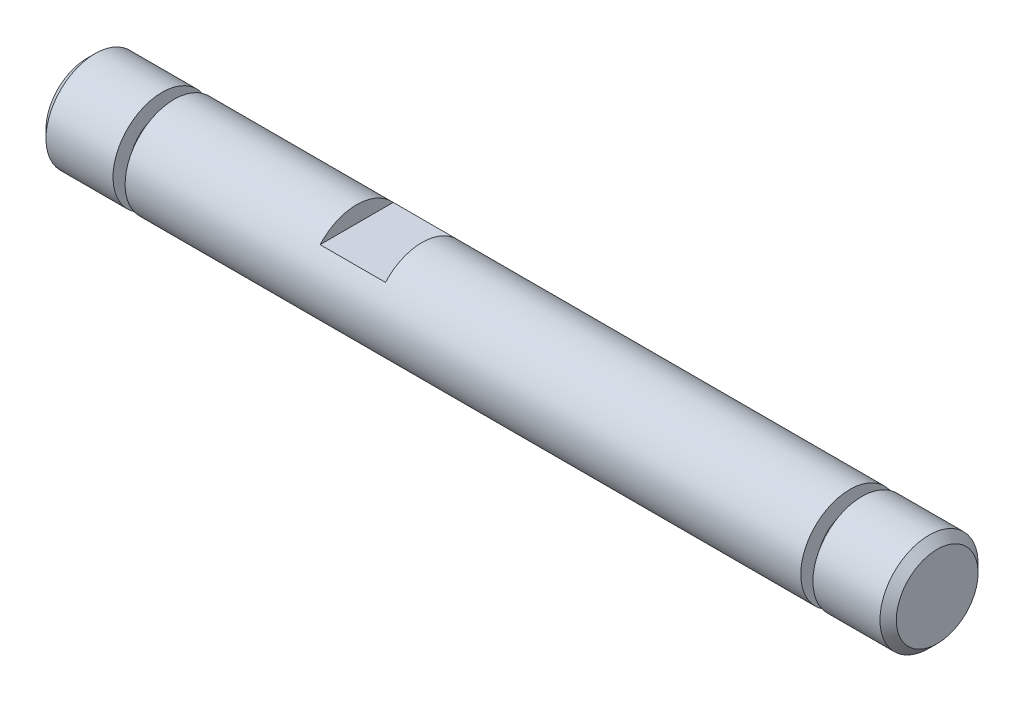
from build123d import *

# Parameters (mm, degrees)
ESQUISSE1_W                  = 52
ESQUISSE1_H                  = 3
CHANFREIN1_SIZE              = 0.5
ENL_V_MAT_EXTRU_1_DEPTH      = 27.343879745
ENL_V_MAT_EXTRU_1_DEPTH_BACK = 27.343879745
ESQUISSE2_W                  = 4
ESQUISSE2_H                  = 2
ESQUISSE3_W                  = 0.74
ESQUISSE3_H                  = 1


with BuildPart() as part:
    # Esquisse1 → Révolution1 (revolve)
    with BuildSketch(Plane.XY):
        with Locations((0, 1.5)):
            Rectangle(ESQUISSE1_W, ESQUISSE1_H)
    revolve(axis=Axis((0, 0, 0), (1, 0, 0)))

    # Chanfrein1
    chanfrein1_edges = [part.edges().sort_by_distance(p)[0] for p in [
        (-26, -3, 0),
        (26, -3, 0),
    ]]
    chamfer(chanfrein1_edges, length=CHANFREIN1_SIZE)

    # Esquisse2 → Enlèv. mat.-Extru.1 (cut, two sides: drawn at the far end of the back side and taken through both)
    with BuildSketch(Plane.XY.offset(-ENL_V_MAT_EXTRU_1_DEPTH_BACK)):
        with Locations((-7.5, 3)):
            Rectangle(ESQUISSE2_W, ESQUISSE2_H)
    extrude(amount=ENL_V_MAT_EXTRU_1_DEPTH + ENL_V_MAT_EXTRU_1_DEPTH_BACK, mode=Mode.SUBTRACT)

    # Esquisse3 → Enlèvement de matière-Révolution1 (revolve, cut)
    with BuildSketch(Plane.XY):
        with Locations((-21.03, 2.5)):
            Rectangle(ESQUISSE3_W, ESQUISSE3_H)
        with Locations((21.03, 2.5)):
            Rectangle(ESQUISSE3_W, ESQUISSE3_H)
    revolve(axis=Axis((0, 0, 0), (-1, 0, 0)), mode=Mode.SUBTRACT)


solid = part.part
